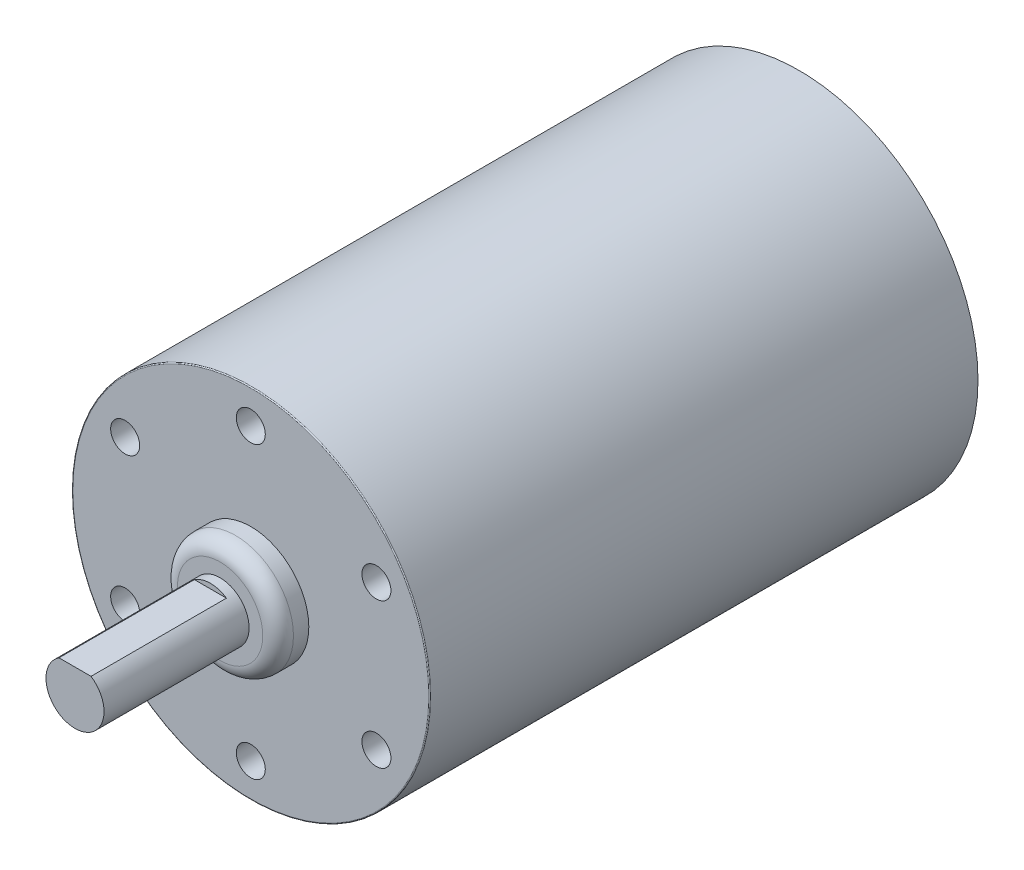
from build123d import *

# Parameters (mm, degrees)
SKETCH1_R           = 18.5
BOSS_EXTRUDE1_DEPTH = 56.6928
FILLET3_R           = 0.1
SKETCH2_R           = 6
BOSS_EXTRUDE2_DEPTH = 3.175
FILLET2_R           = 1.5875
SKETCH5_R           = 3
BOSS_EXTRUDE3_DEPTH = 15
CUT_EXTRUDE1_START  = -14
CUT_EXTRUDE1_DEPTH  = 14
SKETCH7_R           = 1.5
CUT_EXTRUDE2_DEPTH  = 10


with BuildPart() as part:
    # Sketch1 → Boss-Extrude1 (new body)
    with BuildSketch(Plane.XY):
        Circle(SKETCH1_R)
    extrude(amount=BOSS_EXTRUDE1_DEPTH)

    # Fillet3
    fillet3_edges = [part.edges().sort_by_distance(p)[0] for p in [
        (-18.5, 0, 56.6928),
    ]]
    fillet(fillet3_edges, radius=FILLET3_R)

    # Sketch2 → Boss-Extrude2 (add)
    with BuildSketch(Plane.XY.offset(56.6928)):
        Circle(SKETCH2_R)
    extrude(amount=BOSS_EXTRUDE2_DEPTH)

    # Fillet2
    fillet2_edges = [part.edges().sort_by_distance(p)[0] for p in [
        (-6, 0, 59.8678),
    ]]
    fillet(fillet2_edges, radius=FILLET2_R)

    # Sketch5 → Boss-Extrude3 (add)
    with BuildSketch(Plane.XY.offset(59.8678)):
        Circle(SKETCH5_R)
    extrude(amount=BOSS_EXTRUDE3_DEPTH)

    # Sketch6 → Cut-Extrude1 (cut)
    with BuildSketch(Plane.XY.offset(74.8678).offset(CUT_EXTRUDE1_START)):
        with BuildLine():
            Line((-1.658312395, 2.5), (1.658312395, 2.5))
            ThreePointArc((1.658312395, 2.5), (0, 3), (-1.658312395, 2.5))
        make_face()
    extrude(amount=CUT_EXTRUDE1_DEPTH, mode=Mode.SUBTRACT)

    # Sketch7 → Cut-Extrude2 (cut)
    with BuildSketch(Plane.XY.offset(56.6928)):
        with Locations((0, 15)):
            Circle(SKETCH7_R)
        with Locations((12.990381057, 7.5)):
            Circle(SKETCH7_R)
        with Locations((12.990381057, -7.5)):
            Circle(SKETCH7_R)
        with Locations((0, -15)):
            Circle(SKETCH7_R)
        with Locations((-12.990381057, -7.5)):
            Circle(SKETCH7_R)
        with Locations((-12.990381057, 7.5)):
            Circle(SKETCH7_R)
    extrude(amount=-CUT_EXTRUDE2_DEPTH, mode=Mode.SUBTRACT)


solid = part.part
